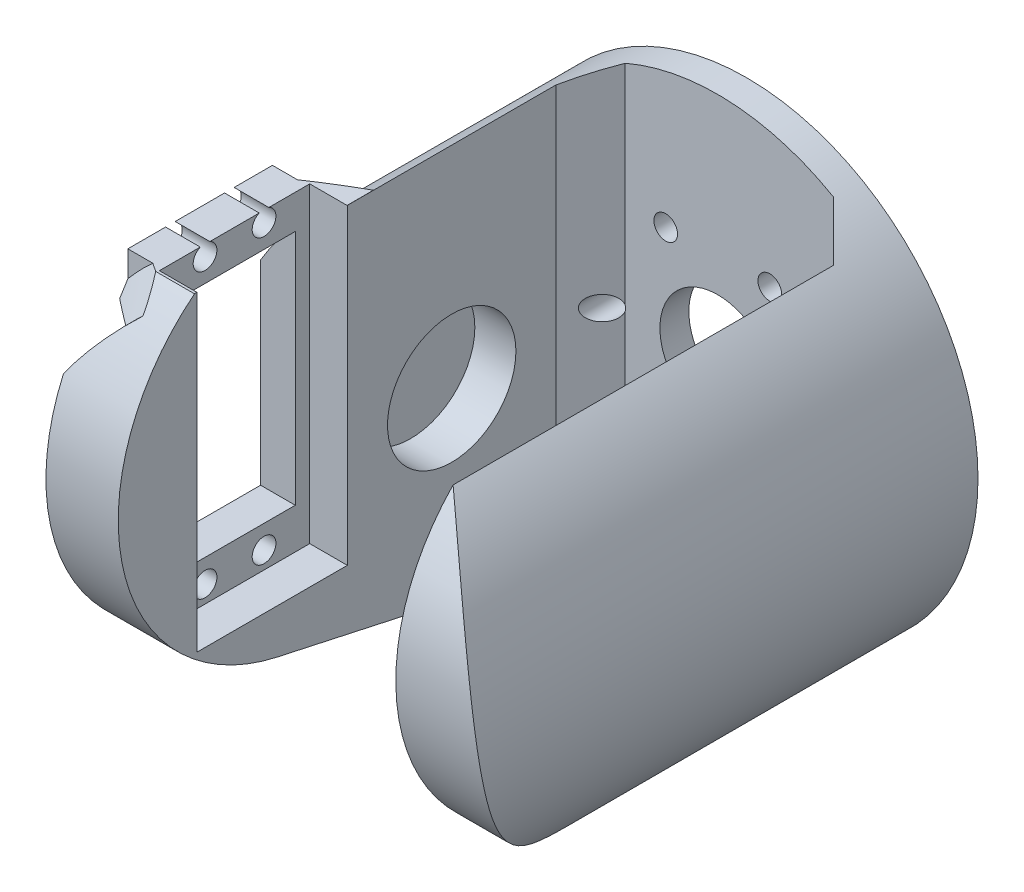
from build123d import *
from build123d.topology import SkipClean

# Parameters (mm, degrees)
SKETCH3_R           = 40
SKETCH3_R_2         = 2.05
SKETCH3_R_3         = 10
BOSS_EXTRUDE1_DEPTH = 5
BOSS_EXTRUDE2_DEPTH = 41
SKETCH5_W           = 112.43258682
SKETCH5_H           = 89.925085182
CUT_EXTRUDE1_DEPTH  = 100
CUT_EXTRUDE2_START  = 5
CUT_EXTRUDE2_DEPTH  = 82
CUT_EXTRUDE3_START  = -22
SKETCH7_R           = 11.1
CUT_EXTRUDE3_DEPTH  = 7.1
BOSS_EXTRUDE3_START = -22
SKETCH9_W           = 6.75
SKETCH9_H           = 25
BOSS_EXTRUDE3_DEPTH = 12.5
SKETCH8_R           = 2.05
SKETCH8_W           = 41
SKETCH8_H           = 21
CUT_EXTRUDE5_DEPTH  = 50
CHAMFER1_SIZE       = 5
CHAMFER2_SIZE       = 6
CUT_EXTRUDE6_START  = 33
SKETCH10_R          = 11.1
CUT_EXTRUDE6_DEPTH  = 7
CUT_EXTRUDE7_START  = -22
SKETCH11_W          = 55
SKETCH11_H          = 26
CUT_EXTRUDE7_DEPTH  = 6.5


with BuildPart() as part:
    # Sketch3 → Boss-Extrude1 (new body)
    with BuildSketch(Plane(origin=(0, 0, 0), x_dir=(0, 1, 0), z_dir=(0, 0, 1))):
        with Locations(Location((0, 0, 0), (0, 0, 270))):
            Circle(SKETCH3_R)
        with Locations(Location((0, 18, 0), (0, 0, 270))):
            Circle(SKETCH3_R_2, mode=Mode.SUBTRACT)
        with Locations(Location((15.588457268, 9, 0), (0, 0, 270))):
            Circle(SKETCH3_R_2, mode=Mode.SUBTRACT)
        with Locations(Location((15.588457268, -9, 0), (0, 0, 270))):
            Circle(SKETCH3_R_2, mode=Mode.SUBTRACT)
        with Locations(Location((0, -18, 0), (0, 0, 270))):
            Circle(SKETCH3_R_2, mode=Mode.SUBTRACT)
        with Locations(Location((-15.588457268, -9, 0), (0, 0, 270))):
            Circle(SKETCH3_R_2, mode=Mode.SUBTRACT)
        with Locations(Location((-15.588457268, 9, 0), (0, 0, 270))):
            Circle(SKETCH3_R_2, mode=Mode.SUBTRACT)
        with Locations(Location((0, 0, 0), (0, 0, 270))):
            Circle(SKETCH3_R_3, mode=Mode.SUBTRACT)
    extrude(amount=BOSS_EXTRUDE1_DEPTH)

    # Sketch4 → Boss-Extrude2 (add, symmetric)
    with BuildSketch(Plane.YZ):
        with BuildLine():
            Line((-40, 5), (-28.187426516, 59.125004254))
            ThreePointArc((-28.187426516, 59.125004254), (5.55857639, 86.659175658), (40, 60))
            Line((40, 60), (40, 5))
            Line((40, 5), (-40, 5))
        make_face()
    extrude(amount=BOSS_EXTRUDE2_DEPTH, both=True)

    # Sketch5 → Cut-Extrude1 (cut)
    with SkipClean():  # the faces are left unmerged after this step: merging them gives an invalid solid
        with BuildSketch(Plane(origin=(0, 0, 0), x_dir=(0, 1, 0), z_dir=(0, 0, 1))):
            Rectangle(SKETCH5_W, SKETCH5_H)
            with BuildLine():
                Line((-20.24228248, 34.5), (20.24228248, 34.5))
                ThreePointArc((20.24228248, 34.5), (0, -40), (-20.24228248, 34.5))
            make_face(mode=Mode.SUBTRACT)
        extrude(amount=CUT_EXTRUDE1_DEPTH, mode=Mode.SUBTRACT)
    add(part.part.scale(1), mode=Mode.REPLACE)  # the faces are merged on a copy

    # Sketch6 → Cut-Extrude2 (cut)
    with BuildSketch(Plane(origin=(0, 0, 0), x_dir=(0, 1, 0), z_dir=(0, 0, 1)).offset(CUT_EXTRUDE2_START)):
        with BuildLine():
            Line((-13.85765721, -26), (13.85765721, -26))
            Line((13.85765721, -26), (30.397368307, -26))
            ThreePointArc((30.397368307, -26), (39.921625117, -2.502768077), (33.406586177, 22))
            Line((33.406586177, 22), (-33.406586177, 22))
            ThreePointArc((-33.406586177, 22), (-39.921625117, -2.502768077), (-30.397368307, -26))
            Line((-30.397368307, -26), (-13.85765721, -26))
        make_face()
        with BuildLine():
            Line((-20.24228248, 34.5), (20.24228248, 34.5))
            ThreePointArc((20.24228248, 34.5), (0, 40), (-20.24228248, 34.5))
        make_face()
    extrude(amount=CUT_EXTRUDE2_DEPTH, mode=Mode.SUBTRACT)

    # Sketch7 → Cut-Extrude3 (cut)
    with BuildSketch(Plane.YZ.offset(CUT_EXTRUDE3_START)):
        with Locations(Location((-3, 29, 0), (0, 0, 270))):
            Circle(SKETCH7_R)
    extrude(amount=-CUT_EXTRUDE3_DEPTH, mode=Mode.SUBTRACT)

    # Sketch9 → Boss-Extrude3 (add)
    with BuildSketch(Plane.YZ.offset(BOSS_EXTRUDE3_START)):
        with Locations((30, 59.998090913)):
            Rectangle(SKETCH9_W, SKETCH9_H)
    extrude(amount=-BOSS_EXTRUDE3_DEPTH)

    # Sketch8 → Cut-Extrude5 (cut)
    with BuildSketch(Plane.YZ):
        with Locations(Location((-17.5, 65.15, 0), (0, 0, 270))):
            Circle(SKETCH8_R)
        with Locations(Location((-17.5, 54.95, 0), (0, 0, 270))):
            Circle(SKETCH8_R)
        with Locations((31.5, 54.95)):
            Circle(SKETCH8_R)
        with Locations((31.5, 65.15)):
            Circle(SKETCH8_R)
        with Locations((7, 60.05)):
            Rectangle(SKETCH8_W, SKETCH8_H)
    extrude(amount=-CUT_EXTRUDE5_DEPTH, mode=Mode.SUBTRACT)

    # Chamfer1
    # the kernel refuses this chamfer: 5 mm, written as the material it adds along each edge
    with BuildSketch(Plane(origin=(0, 0, 72.498090913), x_dir=(-0.9183651186253444, 0.39573413915437844, 0), z_dir=(-0.39573413915437844, -0.9183651186253444, 0))) as chamfer1_piece_1_section:
        Polygon((40, -CHAMFER1_SIZE), (40 + CHAMFER1_SIZE, 0), (40, 0), align=None)
    chamfer1_piece_1 = revolve(axis=Axis((0, 0, 72.498090913), (0, 0, -1)), revolution_arc=51.657569858, mode=Mode.PRIVATE)
    chamfer1_piece_1 = split(chamfer1_piece_1, bisect_by=Plane(origin=(-34.5, 29.836622418, 73.971077773), z_dir=(1, 0, 0)), keep=Keep.TOP, mode=Mode.PRIVATE)
    chamfer1_piece_1 = split(chamfer1_piece_1, bisect_by=Plane(origin=(-22, 29.836622418, 73.971077773), z_dir=(-1, 0, 0)), keep=Keep.TOP, mode=Mode.PRIVATE)
    chamfer1_piece_1 = chamfer1_piece_1 & Plane(origin=(-28.977022362, 6.007666956, 51.662056953), x_dir=(0, -0.9770026706356161, 0.21322706575590716), z_dir=(1, 0, 0)) * Cylinder(35, 180, mode=Mode.PRIVATE)
    chamfer1_piece_1 = split(chamfer1_piece_1, bisect_by=Plane(origin=(-28.977022362, 33.375, 73.971077773), z_dir=(0, -1, 0)), keep=Keep.TOP, mode=Mode.PRIVATE)
    chamfer1_piece_1 = split(chamfer1_piece_1, bisect_by=Plane(origin=(-28.977022362, 26.625, 73.971077773), z_dir=(0, 1, 0)), keep=Keep.TOP, mode=Mode.PRIVATE)
    add(chamfer1_piece_1)
    with BuildSketch(Plane(origin=(0, 0, 47.498090913), x_dir=(-0.9183651186253442, 0.39573413915437894, 0), z_dir=(-0.39573413915437894, -0.9183651186253442, 0))) as chamfer1_piece_2_section:
        Polygon((40, CHAMFER1_SIZE), (40 + CHAMFER1_SIZE, 0), (40, 0), align=None)
    chamfer1_piece_2 = revolve(axis=Axis((0, 0, 47.498090913), (0, 0, -1)), revolution_arc=51.657569858, mode=Mode.PRIVATE)
    chamfer1_piece_2 = split(chamfer1_piece_2, bisect_by=Plane(origin=(-34.5, 30.172032739, 45.811526919), z_dir=(1, 0, 0)), keep=Keep.TOP, mode=Mode.PRIVATE)
    chamfer1_piece_2 = split(chamfer1_piece_2, bisect_by=Plane(origin=(-28.439026237, 26.625, 45.811526919), z_dir=(0, 1, 0)), keep=Keep.TOP, mode=Mode.PRIVATE)
    chamfer1_piece_2 = split(chamfer1_piece_2, bisect_by=Plane(origin=(-28.439026237, 33.375, 45.811526919), z_dir=(0, -1, 0)), keep=Keep.TOP, mode=Mode.PRIVATE)
    chamfer1_piece_2 = split(chamfer1_piece_2, bisect_by=Plane(origin=(-22, 30.172032739, 45.811526919), z_dir=(-1, 0, 0)), keep=Keep.TOP, mode=Mode.PRIVATE)
    add(chamfer1_piece_2)

    # Chamfer2
    # the kernel refuses this chamfer: 6 mm, written as the material it adds along each edge
    with BuildSketch(Plane(origin=(26, -45.827466235, 5), x_dir=(-0.9996219169112969, 0, -0.027495876610586355), z_dir=(0, 1, 0))) as chamfer2_piece_1_section:
        Polygon((CHAMFER2_SIZE * 0.999621916911, CHAMFER2_SIZE * 0.0274958766106), (-CHAMFER2_SIZE * 0.0274958766106, CHAMFER2_SIZE * 0.999621916911), (0, 0), align=None)
    chamfer2_piece_1 = extrude(amount=91.65493247, mode=Mode.PRIVATE)
    chamfer2_piece_1 = chamfer2_piece_1 & Plane(origin=(0, 0, 6.950735371), x_dir=(1, 0, 0), z_dir=(0, 0, -1)) * Cylinder(40, 208, mode=Mode.PRIVATE)
    chamfer2_piece_1 = chamfer2_piece_1 - Plane(origin=(18, 0, 6.950735371), x_dir=(1, 0, 0), z_dir=(0, 0, -1)) * Cylinder(2.05, 208, mode=Mode.PRIVATE)
    add(chamfer2_piece_1)
    with BuildSketch(Plane(origin=(-22, 48.836684105, 5), x_dir=(0.9996219169112969, 0, -0.027495876610586348), z_dir=(0, -1, 0))) as chamfer2_piece_2_section:
        Polygon((CHAMFER2_SIZE * 0.999621916911, CHAMFER2_SIZE * 0.0274958766106), (-CHAMFER2_SIZE * 0.0274958766106, CHAMFER2_SIZE * 0.999621916911), (0, 0), align=None)
    chamfer2_piece_2 = extrude(amount=97.67336821, mode=Mode.PRIVATE)
    chamfer2_piece_2 = chamfer2_piece_2 & Plane(origin=(0, 0, 5.808875482), x_dir=(1, 0, 0), z_dir=(0, 0, -1)) * Cylinder(40, 220, mode=Mode.PRIVATE)
    chamfer2_piece_2 = chamfer2_piece_2 - Plane(origin=(-18, 0, 5.808875482), x_dir=(1, 0, 0), z_dir=(0, 0, -1)) * Cylinder(2.05, 220, mode=Mode.PRIVATE)
    add(chamfer2_piece_2)

    # Sketch10 → Cut-Extrude6 (cut)
    with BuildSketch(Plane.YZ.offset(CUT_EXTRUDE6_START)):
        with Locations(Location((-3, 29, 0), (0, 0, 270))):
            Circle(SKETCH10_R)
    extrude(amount=-CUT_EXTRUDE6_DEPTH, mode=Mode.SUBTRACT)

    # Sketch11 → Cut-Extrude7 (cut)
    with BuildSketch(Plane.YZ.offset(CUT_EXTRUDE7_START)):
        with Locations((7, 60.05)):
            Rectangle(SKETCH11_W, SKETCH11_H)
    extrude(amount=-CUT_EXTRUDE7_DEPTH, mode=Mode.SUBTRACT)


solid = part.part
